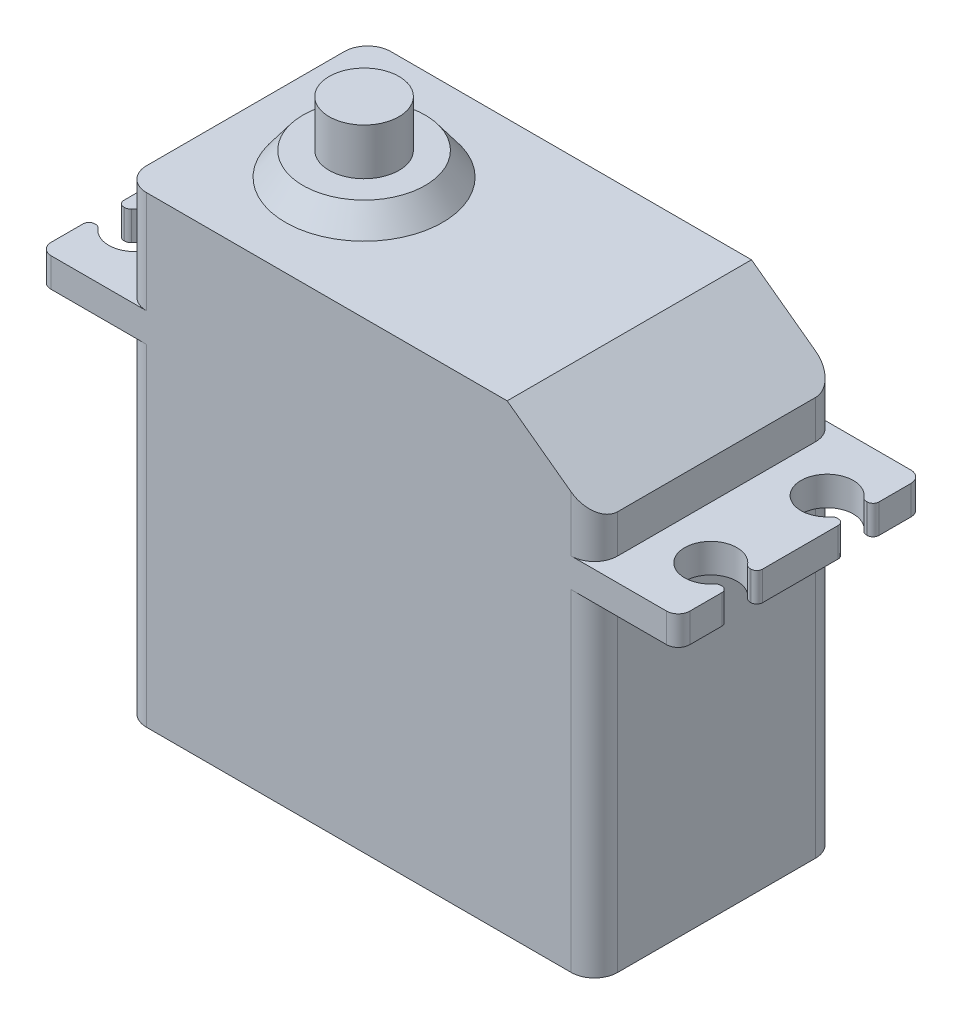
from build123d import *

# Parameters (mm, degrees)
EXTRUSION1_DEPTH = 21
ESQUISSE2_W      = 21
ESQUISSE2_H      = 2.5
EXTRUSION2_DEPTH = 7.2
ESQUISSE3_W      = 21
ESQUISSE3_H      = 2.5
EXTRUSION3_DEPTH = 7.2
EXTRUSION4_REACH = 62.641
ESQUISSE4_R      = 2.25
CONG_1_R         = 1
CONG_2_R         = 2
ESQUISSE5_R      = 3
EXTRUSION5_DEPTH = 6
ESQUISSE7_R      = 6.75
EXTRUSION6_DEPTH = 2
CHANFREIN1_SIZE2 = 1.5
CHANFREIN1_SIZE  = 2
EXTRUSION7_REACH = 62.641
ESQUISSE8_W      = 1
ESQUISSE8_H      = 2.5
CONG_3_R         = 0.5
ESQUISSE9_R      = 7
ESQUISSE9_R_2    = 1.5
EXTRUSION8_DEPTH = 2.4
CONG_4_R         = 0.5


with BuildPart() as part:
    # Esquisse1 → Extrusion1 (new body)
    with BuildSketch(Plane.XY):
        Polygon((0, 0), (40.5, 0), (40.5, 34.3), (33, 39.8), (0, 39.8), align=None)
    extrude(amount=-EXTRUSION1_DEPTH)

    # Esquisse2 → Extrusion2 (add)
    with BuildSketch(Plane(origin=(40.5, 0, 0), x_dir=(0, 0, -1), z_dir=(1, 0, 0))):
        with Locations((10.5, 29.75)):
            Rectangle(ESQUISSE2_W, ESQUISSE2_H)
    extrude(amount=EXTRUSION2_DEPTH)

    # Esquisse3 → Extrusion3 (add)
    with BuildSketch(Plane.ZY):
        with Locations((-10.5, 29.75)):
            Rectangle(ESQUISSE3_W, ESQUISSE3_H)
    extrude(amount=EXTRUSION3_DEPTH)

    # Esquisse4 → Extrusion4 (cut, up to next)
    with BuildSketch(Plane(origin=(0, 31, 0), x_dir=(-1, 0, 0), z_dir=(0, 1, 0)), mode=Mode.PRIVATE) as extrusion4_sk1:
        with Locations((4.5, -15.5)):
            Circle(ESQUISSE4_R)
    extrusion4_tool1 = extrude(extrusion4_sk1.sketch, amount=-EXTRUSION4_REACH, mode=Mode.PRIVATE) & part.part
    # Esquisse4 → Extrusion4 (cut, up to next)
    with BuildSketch(Plane(origin=(0, 31, 0), x_dir=(-1, 0, 0), z_dir=(0, 1, 0)), mode=Mode.PRIVATE) as extrusion4_sk2:
        with Locations(Location((-45, -15.5, 0), (0, 0, 90))):
            Circle(ESQUISSE4_R)
    extrusion4_tool2 = extrude(extrusion4_sk2.sketch, amount=-EXTRUSION4_REACH, mode=Mode.PRIVATE) & part.part
    # Esquisse4 → Extrusion4 (cut, up to next)
    with BuildSketch(Plane(origin=(0, 31, 0), x_dir=(-1, 0, 0), z_dir=(0, 1, 0)), mode=Mode.PRIVATE) as extrusion4_sk3:
        with Locations((-45, -5.5)):
            Circle(ESQUISSE4_R)
    extrusion4_tool3 = extrude(extrusion4_sk3.sketch, amount=-EXTRUSION4_REACH, mode=Mode.PRIVATE) & part.part
    # Esquisse4 → Extrusion4 (cut, up to next)
    with BuildSketch(Plane(origin=(0, 31, 0), x_dir=(-1, 0, 0), z_dir=(0, 1, 0)), mode=Mode.PRIVATE) as extrusion4_sk4:
        with Locations(Location((4.5, -5.5, 0), (0, 0, 90))):
            Circle(ESQUISSE4_R)
    extrusion4_tool4 = extrude(extrusion4_sk4.sketch, amount=-EXTRUSION4_REACH, mode=Mode.PRIVATE) & part.part
    add(extrusion4_tool1.solids().sort_by_distance((-4.5, 31, -15.5))[0], mode=Mode.SUBTRACT)
    add(extrusion4_tool2.solids().sort_by_distance((45, 31, -15.5))[0], mode=Mode.SUBTRACT)
    add(extrusion4_tool3.solids().sort_by_distance((45, 31, -5.5))[0], mode=Mode.SUBTRACT)
    add(extrusion4_tool4.solids().sort_by_distance((-4.5, 31, -5.5))[0], mode=Mode.SUBTRACT)

    # Congé1
    cong_1_edges = [part.edges().sort_by_distance(p)[0] for p in [
        (47.7, 29.75, 0),
        (47.7, 29.75, -21),
        (-7.2, 29.75, -21),
        (-7.2, 29.75, 0),
    ]]
    fillet(cong_1_edges, radius=CONG_1_R)

    # Congé2
    cong_2_edges = [part.edges().sort_by_distance(p)[0] for p in [
        (0, 35.4, -21),
        (0, 14.25, -21),
        (0, 35.4, 0),
        (0, 14.25, 0),
        (40.5, 32.65, 0),
        (40.5, 14.25, 0),
        (40.5, 32.65, -21),
        (40.5, 14.25, -21),
    ]]
    fillet(cong_2_edges, radius=CONG_2_R)

    # Esquisse5 → Extrusion5 (add)
    with BuildSketch(Plane(origin=(0, 39.8, 0), x_dir=(-1, 0, 0), z_dir=(0, 1, 0))):
        with Locations((-10.2, -10.5)):
            Circle(ESQUISSE5_R)
    extrude(amount=EXTRUSION5_DEPTH)

    # Esquisse7 → Extrusion6 (add)
    with BuildSketch(Plane(origin=(0, 39.8, 0), x_dir=(-1, 0, 0), z_dir=(0, 1, 0))):
        with Locations((-10.2, -10.5)):
            Circle(ESQUISSE7_R)
    extrude(amount=EXTRUSION6_DEPTH)

    # Chanfrein1
    chanfrein1_edges = [part.edges().sort_by_distance(p)[0] for p in [
        (16.95, 41.8, -10.5),
    ]]
    chanfrein1_side = [part.faces().sort_by_distance(p)[0] for p in [
        (16.95, 41.77, -10.5),
    ]]
    chamfer(chanfrein1_edges, length=CHANFREIN1_SIZE - 0.0001, length2=CHANFREIN1_SIZE2 - 0.0001, reference=chanfrein1_side[0])  # a hair under: the kernel refuses the full size

    # Esquisse8 → Extrusion7 (cut, up to next)
    with BuildSketch(Plane(origin=(0, 31, 0), x_dir=(-1, 0, 0), z_dir=(0, 1, 0)), mode=Mode.PRIVATE) as extrusion7_sk1:
        with Locations((6.7, -15.5)):
            Rectangle(ESQUISSE8_W, ESQUISSE8_H)
    extrusion7_tool1 = extrude(extrusion7_sk1.sketch, amount=-EXTRUSION7_REACH, mode=Mode.PRIVATE) & part.part
    # Esquisse8 → Extrusion7 (cut, up to next)
    with BuildSketch(Plane(origin=(0, 31, 0), x_dir=(-1, 0, 0), z_dir=(0, 1, 0)), mode=Mode.PRIVATE) as extrusion7_sk2:
        with Locations((6.7, -5.5)):
            Rectangle(ESQUISSE8_W, ESQUISSE8_H)
    extrusion7_tool2 = extrude(extrusion7_sk2.sketch, amount=-EXTRUSION7_REACH, mode=Mode.PRIVATE) & part.part
    # Esquisse8 → Extrusion7 (cut, up to next)
    with BuildSketch(Plane(origin=(0, 31, 0), x_dir=(-1, 0, 0), z_dir=(0, 1, 0)), mode=Mode.PRIVATE) as extrusion7_sk3:
        with Locations((-47.2, -15.5)):
            Rectangle(ESQUISSE8_W, ESQUISSE8_H)
    extrusion7_tool3 = extrude(extrusion7_sk3.sketch, amount=-EXTRUSION7_REACH, mode=Mode.PRIVATE) & part.part
    # Esquisse8 → Extrusion7 (cut, up to next)
    with BuildSketch(Plane(origin=(0, 31, 0), x_dir=(-1, 0, 0), z_dir=(0, 1, 0)), mode=Mode.PRIVATE) as extrusion7_sk4:
        with Locations((-47.2, -5.5)):
            Rectangle(ESQUISSE8_W, ESQUISSE8_H)
    extrusion7_tool4 = extrude(extrusion7_sk4.sketch, amount=-EXTRUSION7_REACH, mode=Mode.PRIVATE) & part.part
    add(extrusion7_tool1.solids().sort_by_distance((-6.7, 31, -15.5))[0], mode=Mode.SUBTRACT)
    add(extrusion7_tool2.solids().sort_by_distance((-6.7, 31, -5.5))[0], mode=Mode.SUBTRACT)
    add(extrusion7_tool3.solids().sort_by_distance((47.2, 31, -15.5))[0], mode=Mode.SUBTRACT)
    add(extrusion7_tool4.solids().sort_by_distance((47.2, 31, -5.5))[0], mode=Mode.SUBTRACT)

    # Congé3
    cong_3_edges = [part.edges().sort_by_distance(p)[0] for p in [
        (-7.2, 29.75, -14.25),
        (-7.2, 29.75, -16.75),
        (-6.370828693, 29.75, -16.75),
        (-6.370828693, 29.75, -14.25),
        (-6.370828693, 29.75, -6.75),
        (-6.370828693, 29.75, -4.25),
        (-7.2, 29.75, -6.75),
        (-7.2, 29.75, -4.25),
        (46.870828693, 29.75, -14.25),
        (46.870828693, 29.75, -16.75),
        (47.7, 29.75, -14.25),
        (47.7, 29.75, -16.75),
        (47.7, 29.75, -6.75),
        (47.7, 29.75, -4.25),
        (46.870828693, 29.75, -6.75),
        (46.870828693, 29.75, -4.25),
    ]]
    fillet(cong_3_edges, radius=CONG_3_R)

    # Esquisse9 → Extrusion8 (add)
    with BuildSketch(Plane.XZ):
        with Locations(Location((10.2, -10.5, 0), (0, 0, 270))):
            Circle(ESQUISSE9_R)
        with Locations(Location((10.2, -10.5, 0), (0, 0, 270))):
            Circle(ESQUISSE9_R_2, mode=Mode.SUBTRACT)
    extrude(amount=EXTRUSION8_DEPTH)

    # Congé4
    cong_4_edges = [part.edges().sort_by_distance(p)[0] for p in [
        (10.2, -2.4, -3.5),
    ]]
    fillet(cong_4_edges, radius=CONG_4_R)


solid = part.part
